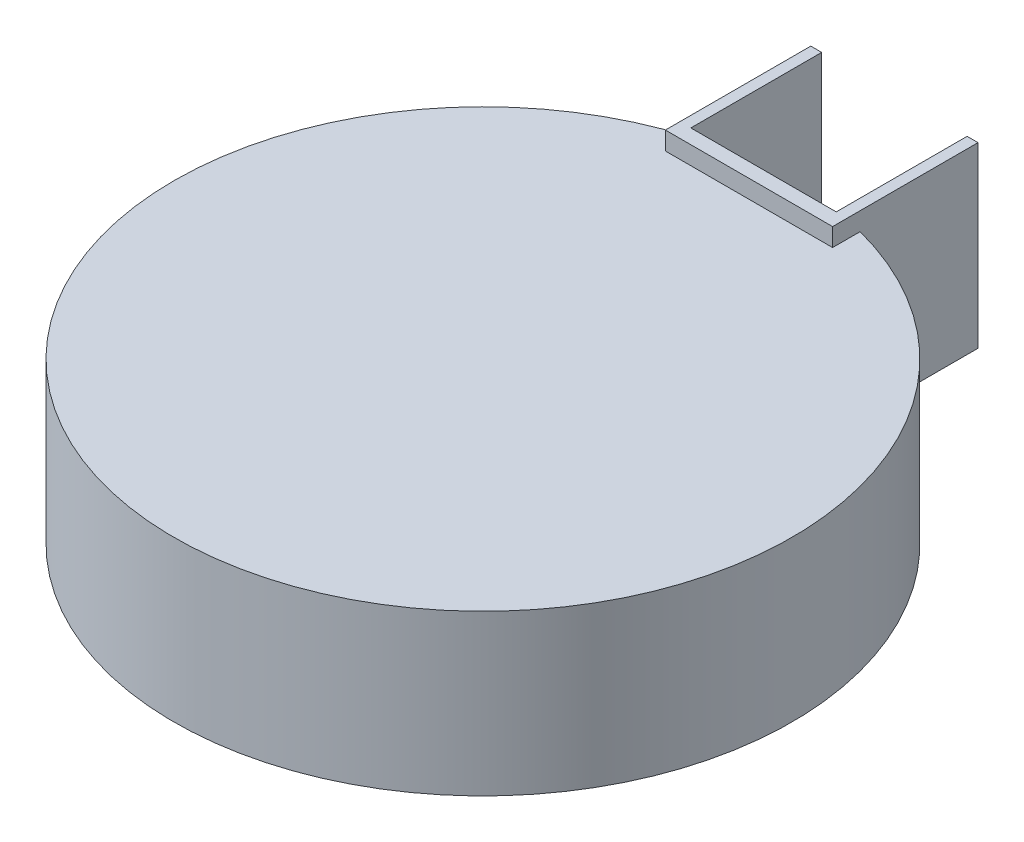
from build123d import *

# Parameters (mm, degrees)
BOSS_EXTRUDE5_OUTLINE_R = 42.5
BOSS_EXTRUDE5_DEPTH     = 22
SKETCH11_W              = 23
SKETCH11_H              = 20
BOSS_EXTRUDE6_DEPTH     = 22
SKETCH12_W              = 23
SKETCH12_H              = 20
CUT_EXTRUDE1_DEPTH      = 19.5
SKETCH13_W              = 20
SKETCH13_H              = 18
CUT_EXTRUDE2_DEPTH      = 39


# Read off the part's stored shape, not the designer's step: Boss-Extrude5
with BuildPart() as part:
    # Boss-Extrude5 outline → Boss-Extrude5 (new body)
    with BuildSketch(Plane(origin=(0, 25, 0), x_dir=(1, 0, 0), z_dir=(0, 1, 0))):
        Circle(BOSS_EXTRUDE5_OUTLINE_R)
    extrude(amount=BOSS_EXTRUDE5_DEPTH)

    # Sketch11 → Boss-Extrude6 (add, symmetric)
    with BuildSketch(Plane(origin=(0, 47, 0), x_dir=(1, 0, 0), z_dir=(0, 1, 0))):
        with Locations((-0.729469309, 47.32480688)):
            Rectangle(SKETCH11_W, SKETCH11_H)
    extrude(amount=BOSS_EXTRUDE6_DEPTH, both=True)

    # Sketch12 → Cut-Extrude1 (cut, symmetric)
    with BuildSketch(Plane(origin=(0, 69, 0), x_dir=(1, 0, 0), z_dir=(0, 1, 0))):
        with Locations((-0.729469309, 47.32480688)):
            Rectangle(SKETCH12_W, SKETCH12_H)
    extrude(amount=CUT_EXTRUDE1_DEPTH, both=True, mode=Mode.SUBTRACT)

    # Sketch13 → Cut-Extrude2 (cut)
    with BuildSketch(Plane(origin=(0, 49.5, 0), x_dir=(1, 0, 0), z_dir=(0, 1, 0))):
        with Locations((-0.729469309, 48.32480688)):
            Rectangle(SKETCH13_W, SKETCH13_H)
    extrude(amount=-CUT_EXTRUDE2_DEPTH, mode=Mode.SUBTRACT)


solid = part.part
